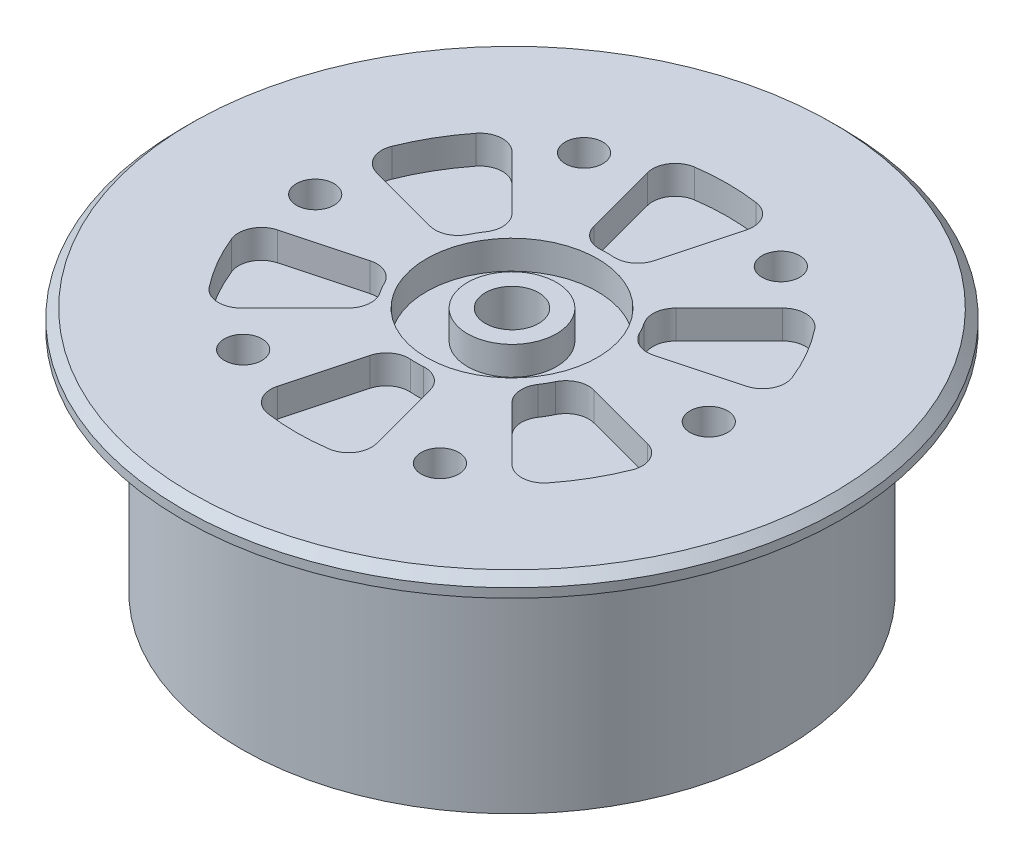
from build123d import *

# Parameters (mm, degrees)
SKETCH_1_R             = 28.9
EXTRUDE_1_DEPTH        = 1.6
CHAMFER_1_SIZE         = 0.8
SKETCH_2_R             = 23.75
EXTRUDE_2_DEPTH        = 20
HOLE_WIZARD_M4_1_D     = 3.3
HOLE_WIZARD_M4_1_DEPTH = 9.008579979
HOLE_WIZARD_M4_1_TIP   = 0.991420021
SKETCH_3_R             = 7.5
CUT_EXTRUDE_1_DEPTH    = 2.5
SKETCH_7_R             = 3.9
EXTRUDE_3_DEPTH        = 2.5
SKETCH_8_R             = 2.34
CUT_EXTRUDE_2_DEPTH    = 10


with BuildPart() as part:
    # 草图1 → 凸台-拉伸1 (new body)
    with BuildSketch(Plane(origin=(0, 0, 0), x_dir=(1, 0, 0), z_dir=(0, 1, 0))):
        Circle(SKETCH_1_R)
    extrude(amount=EXTRUDE_1_DEPTH)

    # 倒角1
    chamfer_1_edges = [part.edges().sort_by_distance(p)[0] for p in [
        (-28.9, 1.6, 0),
    ]]
    chamfer(chamfer_1_edges, length=CHAMFER_1_SIZE)

    # 草图2 → 凸台-拉伸2 (add)
    with BuildSketch(Plane.XZ):
        Circle(SKETCH_2_R)
    extrude(amount=EXTRUDE_2_DEPTH)

    # M4 螺纹孔的螺纹孔钻头1
    with Locations(Plane(origin=(0, 1.6, 0), x_dir=(1, 0, 0), z_dir=(0, 1, 0))):
        with Locations((-17.25, 0), (-8.625, 14.938938215), (8.625, 14.938938215), (17.25, 0), (8.625, -14.938938215), (-8.625, -14.938938215)):
            Hole(HOLE_WIZARD_M4_1_D / 2, depth=HOLE_WIZARD_M4_1_DEPTH)
            with Locations((0, 0, -(HOLE_WIZARD_M4_1_DEPTH + HOLE_WIZARD_M4_1_TIP / 2))):  # 118° drill point
                Cone(0, HOLE_WIZARD_M4_1_D / 2, HOLE_WIZARD_M4_1_TIP, mode=Mode.SUBTRACT)

    # 草图3 → 切除-拉伸1 (cut)
    with BuildSketch(Plane(origin=(0, 1.6, 0), x_dir=(1, 0, 0), z_dir=(0, 1, 0))):
        Circle(SKETCH_3_R)
        with BuildLine():
            Line((-2.628287969, 9.808904238), (-4.34330439, 16.209432654))
            ThreePointArc((-4.34330439, 16.209432654), (-4.081182154, 17.827981129), (-2.696831759, 18.706605744))
            ThreePointArc((-2.696831759, 18.706605744), (0, 18.9), (2.696831759, 18.706605744))
            ThreePointArc((2.696831759, 18.706605744), (4.081182154, 17.827981129), (4.34330439, 16.209432654))
            Line((4.34330439, 16.209432654), (2.628287969, 9.808904238))
            ThreePointArc((2.628287969, 9.808904238), (1.859855262, 8.699749054), (0.561859251, 8.331075212))
            ThreePointArc((0.561859251, 8.331075212), (0, 8.35), (-0.561859251, 8.331075212))
            ThreePointArc((-0.561859251, 8.331075212), (-1.859855262, 8.699749054), (-2.628287969, 9.808904238))
        make_face()
        with BuildLine():
            Line((9.808904238, 2.628287969), (16.209432654, 4.34330439))
            ThreePointArc((16.209432654, 4.34330439), (17.480075633, 5.379583142), (17.548811672, 7.017778059))
            ThreePointArc((17.548811672, 7.017778059), (16.367880132, 9.45), (14.851979913, 11.688827685))
            ThreePointArc((14.851979913, 11.688827685), (13.398893479, 12.448397987), (11.866128265, 11.866128265))
            Line((11.866128265, 11.866128265), (7.180616269, 7.180616269))
            ThreePointArc((7.180616269, 7.180616269), (6.604276056, 5.960556431), (6.933993149, 4.65212199))
            ThreePointArc((6.933993149, 4.65212199), (7.231312122, 4.175), (7.495852399, 3.678953221))
            ThreePointArc((7.495852399, 3.678953221), (8.464131318, 2.739192623), (9.808904238, 2.628287969))
        make_face()
        with BuildLine():
            Line((7.180616269, -7.180616269), (11.866128265, -11.866128265))
            ThreePointArc((11.866128265, -11.866128265), (13.398893479, -12.448397987), (14.851979913, -11.688827685))
            ThreePointArc((14.851979913, -11.688827685), (16.367880132, -9.45), (17.548811672, -7.017778059))
            ThreePointArc((17.548811672, -7.017778059), (17.480075633, -5.379583142), (16.209432654, -4.34330439))
            Line((16.209432654, -4.34330439), (9.808904238, -2.628287969))
            ThreePointArc((9.808904238, -2.628287969), (8.464131318, -2.739192623), (7.495852399, -3.678953221))
            ThreePointArc((7.495852399, -3.678953221), (7.231312122, -4.175), (6.933993149, -4.65212199))
            ThreePointArc((6.933993149, -4.65212199), (6.604276056, -5.960556431), (7.180616269, -7.180616269))
        make_face()
        with BuildLine():
            Line((-2.628287969, -9.808904238), (-4.34330439, -16.209432654))
            ThreePointArc((-4.34330439, -16.209432654), (-4.081182154, -17.827981129), (-2.696831759, -18.706605744))
            ThreePointArc((-2.696831759, -18.706605744), (0, -18.9), (2.696831759, -18.706605744))
            ThreePointArc((2.696831759, -18.706605744), (4.081182154, -17.827981129), (4.34330439, -16.209432654))
            Line((4.34330439, -16.209432654), (2.628287969, -9.808904238))
            ThreePointArc((2.628287969, -9.808904238), (1.859855262, -8.699749054), (0.561859251, -8.331075212))
            ThreePointArc((0.561859251, -8.331075212), (0, -8.35), (-0.561859251, -8.331075212))
            ThreePointArc((-0.561859251, -8.331075212), (-1.859855262, -8.699749054), (-2.628287969, -9.808904238))
        make_face()
        with BuildLine():
            Line((-9.808904238, -2.628287969), (-16.209432654, -4.34330439))
            ThreePointArc((-16.209432654, -4.34330439), (-17.480075633, -5.379583142), (-17.548811672, -7.017778059))
            ThreePointArc((-17.548811672, -7.017778059), (-16.367880132, -9.45), (-14.851979913, -11.688827685))
            ThreePointArc((-14.851979913, -11.688827685), (-13.398893479, -12.448397987), (-11.866128265, -11.866128265))
            Line((-11.866128265, -11.866128265), (-7.180616269, -7.180616269))
            ThreePointArc((-7.180616269, -7.180616269), (-6.604276056, -5.960556431), (-6.933993149, -4.65212199))
            ThreePointArc((-6.933993149, -4.65212199), (-7.231312122, -4.175), (-7.495852399, -3.678953221))
            ThreePointArc((-7.495852399, -3.678953221), (-8.464131318, -2.739192623), (-9.808904238, -2.628287969))
        make_face()
        with BuildLine():
            Line((-7.180616269, 7.180616269), (-11.866128265, 11.866128265))
            ThreePointArc((-11.866128265, 11.866128265), (-13.398893479, 12.448397987), (-14.851979913, 11.688827685))
            ThreePointArc((-14.851979913, 11.688827685), (-16.367880132, 9.45), (-17.548811672, 7.017778059))
            ThreePointArc((-17.548811672, 7.017778059), (-17.480075633, 5.379583142), (-16.209432654, 4.34330439))
            Line((-16.209432654, 4.34330439), (-9.808904238, 2.628287969))
            ThreePointArc((-9.808904238, 2.628287969), (-8.464131318, 2.739192623), (-7.495852399, 3.678953221))
            ThreePointArc((-7.495852399, 3.678953221), (-7.231312122, 4.175), (-6.933993149, 4.65212199))
            ThreePointArc((-6.933993149, 4.65212199), (-6.604276056, 5.960556431), (-7.180616269, 7.180616269))
        make_face()
    extrude(amount=-CUT_EXTRUDE_1_DEPTH, mode=Mode.SUBTRACT)

    # 草图7 → 凸台-拉伸3 (add)
    with BuildSketch(Plane(origin=(0, -0.9, 0), x_dir=(1, 0, 0), z_dir=(0, 1, 0))):
        Circle(SKETCH_7_R)
    extrude(amount=EXTRUDE_3_DEPTH)

    # 草图8 → 切除-拉伸2 (cut)
    with BuildSketch(Plane(origin=(0, 1.6, 0), x_dir=(1, 0, 0), z_dir=(0, 1, 0))):
        Circle(SKETCH_8_R)
    extrude(amount=-CUT_EXTRUDE_2_DEPTH, mode=Mode.SUBTRACT)


solid = part.part
